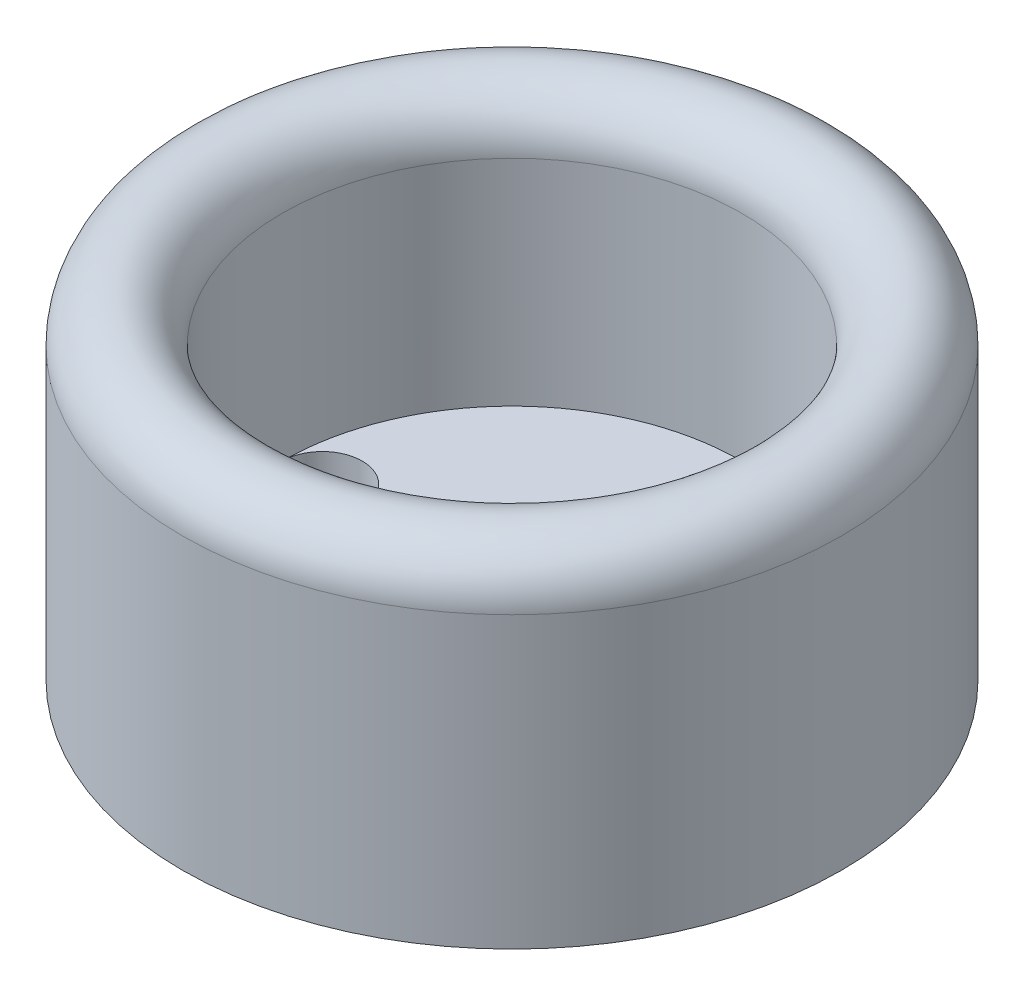
from build123d import *

# Parameters (mm, degrees)
SKETCH1_R           = 25
SKETCH1_R_2         = 1.8
SKETCH1_R_3         = 5.5
BOSS_EXTRUDE1_DEPTH = 7.5
SKETCH2_R           = 4
CUT_EXTRUDE1_DEPTH  = 6
BOSS_EXTRUDE2_START = -7.5
SKETCH3_R           = 33
SKETCH3_R_2         = 23
BOSS_EXTRUDE2_DEPTH = 26.5
FILLET1_R           = 5
SKETCH3_2_R         = 33
SKETCH3_2_R_2       = 23
BOSS_EXTRUDE3_DEPTH = 7.5


with BuildPart() as part:
    # Sketch1 → Boss-Extrude1 (new body)
    with BuildSketch(Plane(origin=(0, 0, 0), x_dir=(1, 0, 0), z_dir=(0, 1, 0))):
        with Locations(Location((0, 0, 0), (0, 0, 270))):
            Circle(SKETCH1_R)
        with Locations(Location((-19, 0, 0), (0, 0, 270))):
            Circle(SKETCH1_R_2, mode=Mode.SUBTRACT)
        with Locations(Location((19, 0, 0), (0, 0, 90))):
            Circle(SKETCH1_R_2, mode=Mode.SUBTRACT)
        with Locations(Location((0, 0, 0), (0, 0, 270))):
            Circle(SKETCH1_R_3, mode=Mode.SUBTRACT)
    extrude(amount=BOSS_EXTRUDE1_DEPTH)

    # Sketch2 → Cut-Extrude1 (cut)
    with BuildSketch(Plane(origin=(0, 7.5, 0), x_dir=(1, 0, 0), z_dir=(0, 1, 0))):
        with Locations(Location((-19, 0, 0), (0, 0, 270))):
            Circle(SKETCH2_R)
        with Locations(Location((19, 0, 0), (0, 0, 270))):
            Circle(SKETCH2_R)
    extrude(amount=-CUT_EXTRUDE1_DEPTH, mode=Mode.SUBTRACT)

    # Sketch3 → Boss-Extrude2 (add)
    with BuildSketch(Plane.XZ.offset(BOSS_EXTRUDE2_START)):
        with Locations(Location((0, 0, 0), (0, 0, 90))):
            Circle(SKETCH3_R)
        with Locations(Location((0, 0, 0), (0, 0, 180.000077522))):
            Circle(SKETCH3_R_2, mode=Mode.SUBTRACT)
    extrude(amount=-BOSS_EXTRUDE2_DEPTH)

    # Fillet1
    fillet1_edges = [part.edges().sort_by_distance(p)[0] for p in [
        (0, 34, -33),
        (23, 34, 3.1119e-05),
    ]]
    fillet(fillet1_edges, radius=FILLET1_R - 0.0001)  # a hair under: the kernel refuses the full size

    # Sketch3<2> → Boss-Extrude3 (add)
    with BuildSketch(Plane.XZ):
        with Locations(Location((0, 0, 0), (0, 0, 270))):
            Circle(SKETCH3_2_R)
        with Locations(Location((0, 0, 0), (0, 0, 180.000077522))):
            Circle(SKETCH3_2_R_2, mode=Mode.SUBTRACT)
    extrude(amount=-BOSS_EXTRUDE3_DEPTH)


solid = part.part
